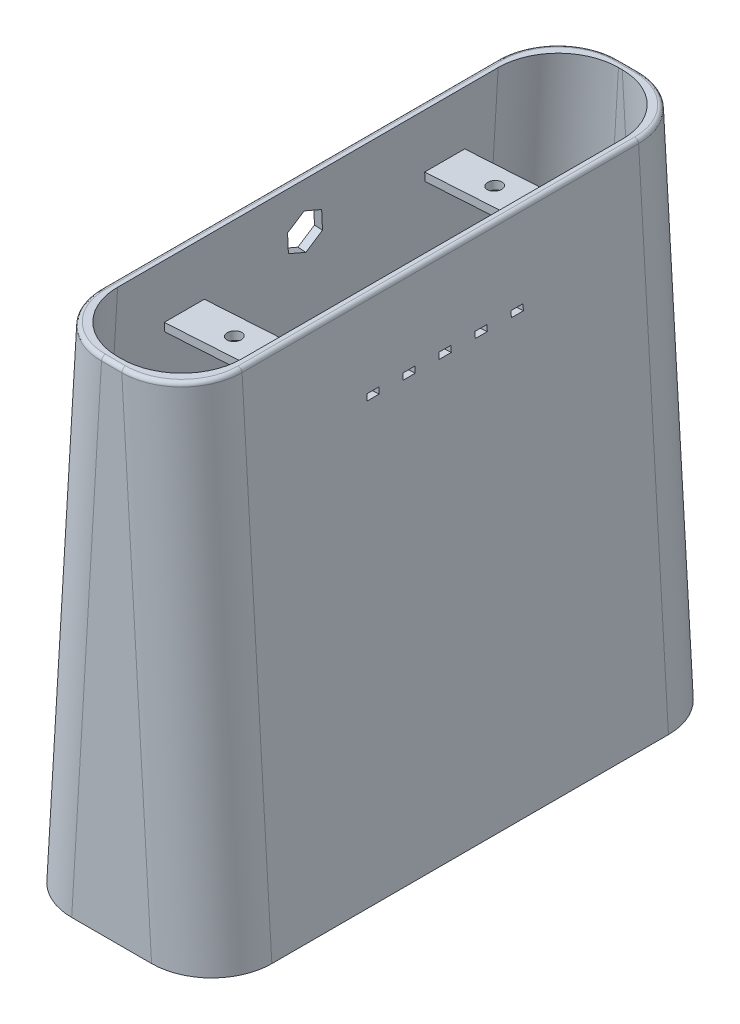
from build123d import *

# Parameters (mm, degrees)
BOSS_EXTRU_1_DEPTH       = 2
BOSS_EXTRU_2_DEPTH       = 125
BOSS_EXTRU_3_DEPTH       = 2
ESQUISSE13_W             = 3
ESQUISSE13_H             = 1.5
ENL_V_MAT_EXTRU_2_DEPTH  = 2
ESQUISSE18_W             = 5
ESQUISSE18_H             = 5
BOSS_EXTRU_8_DEPTH       = 6.5
CONG_2_R                 = 15
CONG_3_R                 = 15
ESQUISSE19_W             = 12
ESQUISSE19_H             = 20
ENL_V_MAT_EXTRU_3_DEPTH  = 6.5
ESQUISSE21_W             = 3.5
ESQUISSE21_H             = 9
ENL_V_MAT_EXTRU_4_DEPTH  = 6.5
CONG_4_R                 = 1
ESQUISSE22_W             = 14
ESQUISSE22_H             = 22
ENL_V_MAT_EXTRU_5_DEPTH  = 0.5
ESQUISSE23_W             = 10
ESQUISSE23_H             = 2
BOSS_EXTRU_9_DEPTH       = 30
ESQUISSE24_W             = 10
ESQUISSE24_H             = 5
BOSS_EXTRU_11_DEPTH      = 10
ESQUISSE26_R             = 1.75
ENL_V_MAT_EXTRU_6_DEPTH  = 10
ENL_V_MAT_EXTRU_9_DEPTH  = 6
CONG_7_R                 = 1
ESQUISSE25_W             = 10
ESQUISSE25_H             = 5
BOSS_EXTRU_12_DEPTH      = 10
ESQUISSE34_R             = 1.75
ENL_V_MAT_EXTRU_16_DEPTH = 10
ESQUISSE35_R             = 1.75
ENL_V_MAT_EXTRU_17_DEPTH = 10
FILETAGE3_PITCH          = 0.8
FILETAGE4_PITCH          = 0.8
FILETAGE5_PITCH          = 0.8
FILETAGE6_PITCH          = 0.8


with BuildPart() as part:
    # Esquisse9 → Boss.-Extru.1 (new body)
    with BuildSketch(Plane.XY):
        Polygon((-42.5, 125), (-50, 0), (0, 0), (-7.5, 125), align=None)
    extrude(amount=BOSS_EXTRU_1_DEPTH)

    # Esquisse10 → Boss.-Extru.2 (add)
    with BuildSketch(Plane(origin=(0, 0, 0), x_dir=(-1, 0, 0), z_dir=(0, 0, -1))):
        Polygon((2.003596766, 0), (9.503596766, 125), (7.5, 125), (0, 0), align=None)
        Polygon((42.5, 125), (40.496403234, 125), (47.996403234, 0), (50, 0), align=None)
    extrude(amount=BOSS_EXTRU_2_DEPTH)

    # Esquisse11 → Boss.-Extru.3 (add)
    with BuildSketch(Plane(origin=(0, 0, -125), x_dir=(-1, 0, 0), z_dir=(0, 0, -1))):
        Polygon((7.5, 125), (42.5, 125), (50, 0), (0, 0), align=None)
    extrude(amount=BOSS_EXTRU_3_DEPTH)

    # Esquisse13 → Enlèv. mat.-Extru.2 (cut)
    with BuildSketch(Plane(origin=(0, 0, 0), x_dir=(0, 0, -1), z_dir=(0.9982048454657787, 0.05989229072794678, 0))):
        with Locations((44.5, 104.474797864)):
            Rectangle(ESQUISSE13_W, ESQUISSE13_H)
        with Locations((53.5, 104.474797864)):
            Rectangle(ESQUISSE13_W, ESQUISSE13_H)
        with Locations((62.5, 104.474797864)):
            Rectangle(ESQUISSE13_W, ESQUISSE13_H)
        with Locations((71.5, 104.474797864)):
            Rectangle(ESQUISSE13_W, ESQUISSE13_H)
        with Locations((80.5, 104.474797864)):
            Rectangle(ESQUISSE13_W, ESQUISSE13_H)
    extrude(amount=-ENL_V_MAT_EXTRU_2_DEPTH, mode=Mode.SUBTRACT)

    # Esquisse18 → Boss.-Extru.8 (add)
    with BuildSketch(Plane(origin=(-47.824235985, 2.869454159, 0), x_dir=(0, 0, -1), z_dir=(0.9982048454657787, -0.059892290727946586, 0))):
        with Locations((27.5, 9.625385464)):
            Rectangle(ESQUISSE18_W, ESQUISSE18_H)
        with Locations((97.5, 9.625385464)):
            Rectangle(ESQUISSE18_W, ESQUISSE18_H)
    extrude(amount=BOSS_EXTRU_8_DEPTH)

    # Congé2
    cong_2_edges = [part.edges().sort_by_distance(p)[0] for p in [
        (-5.753596766, 62.5, -125),
        (-3.75, 62.5, 2),
        (-5.753596766, 62.5, 0),
        (-44.246403234, 62.5, -125),
        (-44.246403234, 62.5, 0),
        (-3.75, 62.5, -127),
        (-46.25, 62.5, 2),
    ]]
    fillet(cong_2_edges, radius=CONG_2_R)

    # Congé3
    cong_3_edges = [part.edges().sort_by_distance(p)[0] for p in [
        (-46.25, 62.5, -127),
    ]]
    fillet(cong_3_edges, radius=CONG_3_R)

    # Esquisse19 → Enlèv. mat.-Extru.3 (cut)
    with BuildSketch(Plane(origin=(0, 0, -127), x_dir=(-1, 0, 0), z_dir=(0, 0, -1))):
        with Locations((25.013024256, 17.5)):
            Rectangle(ESQUISSE19_W, ESQUISSE19_H)
    extrude(amount=-ENL_V_MAT_EXTRU_3_DEPTH, mode=Mode.SUBTRACT)

    # Esquisse21 → Enlèv. mat.-Extru.4 (cut)
    with BuildSketch(Plane(origin=(0, 0, -127), x_dir=(-1, 0, 0), z_dir=(0, 0, -1))):
        with Locations((24.986975744, 37)):
            Rectangle(ESQUISSE21_W, ESQUISSE21_H)
    extrude(amount=-ENL_V_MAT_EXTRU_4_DEPTH, mode=Mode.SUBTRACT)

    # Congé4
    cong_4_edges = [part.edges().sort_by_distance(p)[0] for p in [
        (-23.236975744, 32.5, -126),
        (-23.236975744, 41.5, -126),
        (-26.736975744, 41.5, -126),
        (-26.736975744, 32.5, -126),
    ]]
    fillet(cong_4_edges, radius=CONG_4_R)

    # Esquisse22 → Enlèv. mat.-Extru.5 (cut)
    with BuildSketch(Plane.XY.offset(-125)):
        with Locations((-25.013024256, 17.5)):
            Rectangle(ESQUISSE22_W, ESQUISSE22_H)
    extrude(amount=-ENL_V_MAT_EXTRU_5_DEPTH, mode=Mode.SUBTRACT)

    # Esquisse23 → Boss.-Extru.9 (add)
    with BuildSketch(Plane(origin=(-1.996409691, -0.119784581, 0), x_dir=(0, 0, 1), z_dir=(-0.9982048454657787, -0.05989229072794677, 0))):
        with Locations((-95, 114.344797864)):
            Rectangle(ESQUISSE23_W, ESQUISSE23_H)
        with Locations((-30, 114.344797864)):
            Rectangle(ESQUISSE23_W, ESQUISSE23_H)
    extrude(amount=BOSS_EXTRU_9_DEPTH)

    # Esquisse24 → Boss.-Extru.11 (add)
    with BuildSketch(Plane(origin=(-47.824235985, 2.869454159, 0), x_dir=(0, 0, -1), z_dir=(0.9982048454657787, -0.059892290727946586, 0))):
        with Locations((20, -0.374614536)):
            Rectangle(ESQUISSE24_W, ESQUISSE24_H)
        with Locations((105, -0.374614536)):
            Rectangle(ESQUISSE24_W, ESQUISSE24_H)
    extrude(amount=BOSS_EXTRU_11_DEPTH)

    # Esquisse26 → Enlèv. mat.-Extru.6 (cut)
    with BuildSketch(Plane(origin=(-6.788479586, 113.141326436, 0), x_dir=(-0.9982048454657787, -0.05989229072794676, 0), z_dir=(0.05989229072794676, -0.9982048454657787, 0))):
        with Locations(Location((19.5, 30, 0), (0, 0, 180))):
            Circle(ESQUISSE26_R)
        with Locations(Location((19.5, 95, 0), (0, 0, 180))):
            Circle(ESQUISSE26_R)
    extrude(amount=-ENL_V_MAT_EXTRU_6_DEPTH, mode=Mode.SUBTRACT)

    # Esquisse28 → Enlèv. mat.-Extru.9 (cut)
    with BuildSketch(Plane(origin=(-49.820645676, 2.989238741, 0), x_dir=(0, 0, 1), z_dir=(-0.9982048454657787, 0.05989229072794659, 0))):
        Polygon((-66.477883631, 113.104165782), (-66.977883631, 108.222226277), (-63, 105.348243822), (-58.522116369, 107.356200873), (-58.022116369, 112.238140378), (-62, 115.112122833), align=None)
    extrude(amount=-ENL_V_MAT_EXTRU_9_DEPTH, mode=Mode.SUBTRACT)

    # Congé7
    cong_7_edges = [part.edges().sort_by_distance(p)[0] for p in [
        (-25, 125, -127),
        (-7.5, 125, -62.5),
        (-25, 125, 2),
        (-42.5, 125, -62.5),
        (-11.906073329, 125, -2.388634958),
        (-38.093926671, 125, -2.388634958),
        (-11.906073329, 125, -122.611365042),
        (-38.093926671, 125, -122.611365042),
    ]]
    fillet(cong_7_edges, radius=CONG_7_R)

    # Esquisse25 → Boss.-Extru.12 (add)
    with BuildSketch(Plane(origin=(-1.996409691, -0.119784581, 0), x_dir=(0, 0, 1), z_dir=(-0.9982048454657787, -0.05989229072794677, 0))):
        with Locations((-105, 2.62)):
            Rectangle(ESQUISSE25_W, ESQUISSE25_H)
        with Locations((-20, 2.62)):
            Rectangle(ESQUISSE25_W, ESQUISSE25_H)
    extrude(amount=BOSS_EXTRU_12_DEPTH)

    # Esquisse34 → Enlèv. mat.-Extru.16 (cut)
    with BuildSketch(Plane(origin=(-0.17216725, -2.869454159, 0), x_dir=(-0.9982048454657787, 0.059892290727946586, 0), z_dir=(-0.05989229072794659, -0.9982048454657788, 0))):
        with Locations(Location((42.910242273, 20, 0), (0, 0, 180))):
            Circle(ESQUISSE34_R)
        with Locations(Location((42.910242273, 105, 0), (0, 0, 180))):
            Circle(ESQUISSE34_R)
    extrude(amount=-ENL_V_MAT_EXTRU_16_DEPTH, mode=Mode.SUBTRACT)

    # Esquisse35 → Enlèv. mat.-Extru.17 (cut)
    with BuildSketch(Plane(origin=(-0.007187075, 0.119784581, 0), x_dir=(-0.9982048454657787, -0.05989229072794677, 0), z_dir=(0.05989229072794678, -0.9982048454657788, 0))):
        with Locations(Location((7, 20, 0), (0, 0, 180))):
            Circle(ESQUISSE35_R)
        with Locations(Location((7, 105, 0), (0, 0, 180))):
            Circle(ESQUISSE35_R)
    extrude(amount=-ENL_V_MAT_EXTRU_17_DEPTH, mode=Mode.SUBTRACT)

    # Filetage3: arcs per turn and ends read off the stored shape
    # Filetage3: the profile of Profil de filetage3 profile screwed along a right-hand helix through 8.75 turns, 8 arcs to a turn; built about Z, then put on its axis
    filetage3_z = Axis((0, 0, 0), (0, 0, 1))
    filetage3_corners = [(1.7497, 0, -0.000173205), (2.1830127, 0, 0.249999999), (2.1830127, 0, 0.349999999), (1.7497, 0, 0.600173203)]
    with BuildLine(mode=Mode.PRIVATE) as filetage3_profile:
        Line(filetage3_corners[0], filetage3_corners[1])
        Line(filetage3_corners[1], filetage3_corners[2])
        Line(filetage3_corners[2], filetage3_corners[3])
        Line(filetage3_corners[3], filetage3_corners[0])
    filetage3_cap = Face(filetage3_profile.wire())
    filetage3_turn_angles = [0, 22.5, 45, 67.5, 90, 112.5, 135, 157.5, 180, 202.5, 225, 247.5, 270, 292.5, 315, 337.5, 360]
    filetage3_turn_weights = [1, 0.9238795325112867, 1, 0.9238795325112867, 1, 0.9238795325112867, 1, 0.9238795325112867, 1, 0.9238795325112867, 1, 0.9238795325112867, 1, 0.9238795325112867, 1, 0.9238795325112867, 1]
    filetage3_turn_rails = [Edge.make_bspline([Vector(p[0], p[1], 0).rotate(filetage3_z, filetage3_turn_angles[k]) / filetage3_turn_weights[k] + Vector(0, 0, p[2] + FILETAGE3_PITCH * filetage3_turn_angles[k] / 360) for k in range(17)], [0, 0, 0, 1, 1, 2, 2, 3, 3, 4, 4, 5, 5, 6, 6, 7, 7, 8, 8, 8], 2, filetage3_turn_weights) for p in filetage3_corners]
    filetage3_turn_sides = [Face.make_surface_from_curves(filetage3_turn_rails[p[0]], filetage3_turn_rails[p[1]]) for p in [(0, 1), (1, 2), (2, 3), (3, 0)]]
    filetage3_last_angles = [2880, 2902.5, 2925, 2947.5, 2970, 2992.5, 3015, 3037.5, 3060, 3082.5, 3105, 3127.5, 3150]
    filetage3_last_weights = [1, 0.9238795325112867, 1, 0.9238795325112867, 1, 0.9238795325112867, 1, 0.9238795325112867, 1, 0.9238795325112867, 1, 0.9238795325112867, 1]
    filetage3_last_rails = [Edge.make_bspline([Vector(p[0], p[1], 0).rotate(filetage3_z, filetage3_last_angles[k]) / filetage3_last_weights[k] + Vector(0, 0, p[2] + FILETAGE3_PITCH * filetage3_last_angles[k] / 360) for k in range(13)], [0, 0, 0, 1, 1, 2, 2, 3, 3, 4, 4, 5, 5, 6, 6, 6], 2, filetage3_last_weights) for p in filetage3_corners]
    filetage3_last_sides = [Face.make_surface_from_curves(filetage3_last_rails[p[0]], filetage3_last_rails[p[1]]) for p in [(0, 1), (1, 2), (2, 3), (3, 0)]]
    filetage3 = Plane(origin=(-43.065271298, -1.297666299, -20), x_dir=(0.998204845, -0.059892291, 0), z_dir=(0.059892291, 0.998204845, 0)) * Solid(Shell([*[p.moved(Location((0, 0, FILETAGE3_PITCH * i))) for i in range(8) for p in filetage3_turn_sides], *filetage3_last_sides, filetage3_cap, filetage3_cap.rotate(filetage3_z, 3150).moved(Location((0, 0, FILETAGE3_PITCH * 3150 / 360)))]))
    add(filetage3, mode=Mode.SUBTRACT)

    # Filetage4: arcs per turn and ends read off the stored shape
    # Filetage4: the profile of Profil de filetage4 profile screwed along a right-hand helix through 7.5 turns, 8 arcs to a turn; built about Z, then put on its axis
    filetage4_z = Axis((0, 0, 0), (0, 0, 1))
    filetage4_corners = [(1.7497, 0, -0.000173205), (2.1830127, 0, 0.249999999), (2.1830127, 0, 0.349999999), (1.7497, 0, 0.600173203)]
    with BuildLine(mode=Mode.PRIVATE) as filetage4_profile:
        Line(filetage4_corners[0], filetage4_corners[1])
        Line(filetage4_corners[1], filetage4_corners[2])
        Line(filetage4_corners[2], filetage4_corners[3])
        Line(filetage4_corners[3], filetage4_corners[0])
    filetage4_cap = Face(filetage4_profile.wire())
    filetage4_turn_angles = [0, 22.5, 45, 67.5, 90, 112.5, 135, 157.5, 180, 202.5, 225, 247.5, 270, 292.5, 315, 337.5, 360]
    filetage4_turn_weights = [1, 0.9238795325112867, 1, 0.9238795325112867, 1, 0.9238795325112867, 1, 0.9238795325112867, 1, 0.9238795325112867, 1, 0.9238795325112867, 1, 0.9238795325112867, 1, 0.9238795325112867, 1]
    filetage4_turn_rails = [Edge.make_bspline([Vector(p[0], p[1], 0).rotate(filetage4_z, filetage4_turn_angles[k]) / filetage4_turn_weights[k] + Vector(0, 0, p[2] + FILETAGE4_PITCH * filetage4_turn_angles[k] / 360) for k in range(17)], [0, 0, 0, 1, 1, 2, 2, 3, 3, 4, 4, 5, 5, 6, 6, 7, 7, 8, 8, 8], 2, filetage4_turn_weights) for p in filetage4_corners]
    filetage4_turn_sides = [Face.make_surface_from_curves(filetage4_turn_rails[p[0]], filetage4_turn_rails[p[1]]) for p in [(0, 1), (1, 2), (2, 3), (3, 0)]]
    filetage4_last_angles = [2520, 2542.5, 2565, 2587.5, 2610, 2632.5, 2655, 2677.5, 2700]
    filetage4_last_weights = [1, 0.9238795325112867, 1, 0.9238795325112867, 1, 0.9238795325112867, 1, 0.9238795325112928, 1]
    filetage4_last_rails = [Edge.make_bspline([Vector(p[0], p[1], 0).rotate(filetage4_z, filetage4_last_angles[k]) / filetage4_last_weights[k] + Vector(0, 0, p[2] + FILETAGE4_PITCH * filetage4_last_angles[k] / 360) for k in range(9)], [0, 0, 0, 1, 1, 2, 2, 3, 3, 4, 4, 4], 2, filetage4_last_weights) for p in filetage4_corners]
    filetage4_last_sides = [Face.make_surface_from_curves(filetage4_last_rails[p[0]], filetage4_last_rails[p[1]]) for p in [(0, 1), (1, 2), (2, 3), (3, 0)]]
    filetage4 = Plane(origin=(-42.646025262, 5.689767619, -105), x_dir=(-0.998204845, 0.059892291, 0), z_dir=(-0.059892291, -0.998204845, 0)) * Solid(Shell([*[p.moved(Location((0, 0, FILETAGE4_PITCH * i))) for i in range(7) for p in filetage4_turn_sides], *filetage4_last_sides, filetage4_cap, filetage4_cap.rotate(filetage4_z, 2700).moved(Location((0, 0, FILETAGE4_PITCH * 2700 / 360)))]))
    add(filetage4, mode=Mode.SUBTRACT)

    # Filetage5: arcs per turn and ends read off the stored shape
    # Filetage5: the profile of Profil de filetage5 profile screwed along a right-hand helix through 7.5 turns, 8 arcs to a turn; built about Z, then put on its axis
    filetage5_z = Axis((0, 0, 0), (0, 0, 1))
    filetage5_corners = [(1.7497, 0, -0.000173206), (2.1830127, 0, 0.249999998), (2.1830127, 0, 0.349999998), (1.7497, 0, 0.600173202)]
    with BuildLine(mode=Mode.PRIVATE) as filetage5_profile:
        Line(filetage5_corners[0], filetage5_corners[1])
        Line(filetage5_corners[1], filetage5_corners[2])
        Line(filetage5_corners[2], filetage5_corners[3])
        Line(filetage5_corners[3], filetage5_corners[0])
    filetage5_cap = Face(filetage5_profile.wire())
    filetage5_turn_angles = [0, 22.5, 45, 67.5, 90, 112.5, 135, 157.5, 180, 202.5, 225, 247.5, 270, 292.5, 315, 337.5, 360]
    filetage5_turn_weights = [1, 0.9238795325112867, 1, 0.9238795325112867, 1, 0.9238795325112867, 1, 0.9238795325112867, 1, 0.9238795325112867, 1, 0.9238795325112867, 1, 0.9238795325112867, 1, 0.9238795325112867, 1]
    filetage5_turn_rails = [Edge.make_bspline([Vector(p[0], p[1], 0).rotate(filetage5_z, filetage5_turn_angles[k]) / filetage5_turn_weights[k] + Vector(0, 0, p[2] + FILETAGE5_PITCH * filetage5_turn_angles[k] / 360) for k in range(17)], [0, 0, 0, 1, 1, 2, 2, 3, 3, 4, 4, 5, 5, 6, 6, 7, 7, 8, 8, 8], 2, filetage5_turn_weights) for p in filetage5_corners]
    filetage5_turn_sides = [Face.make_surface_from_curves(filetage5_turn_rails[p[0]], filetage5_turn_rails[p[1]]) for p in [(0, 1), (1, 2), (2, 3), (3, 0)]]
    filetage5_last_angles = [2520, 2542.5, 2565, 2587.5, 2610, 2632.5, 2655, 2677.5, 2700]
    filetage5_last_weights = [1, 0.9238795325112867, 1, 0.9238795325112867, 1, 0.9238795325112867, 1, 0.9238795325112852, 1]
    filetage5_last_rails = [Edge.make_bspline([Vector(p[0], p[1], 0).rotate(filetage5_z, filetage5_last_angles[k]) / filetage5_last_weights[k] + Vector(0, 0, p[2] + FILETAGE5_PITCH * filetage5_last_angles[k] / 360) for k in range(9)], [0, 0, 0, 1, 1, 2, 2, 3, 3, 4, 4, 4], 2, filetage5_last_weights) for p in filetage5_corners]
    filetage5_last_sides = [Face.make_surface_from_curves(filetage5_last_rails[p[0]], filetage5_last_rails[p[1]]) for p in [(0, 1), (1, 2), (2, 3), (3, 0)]]
    filetage5 = Plane(origin=(-7.353974738, 5.689767619, -20), x_dir=(-0.998204845, -0.059892291, 0), z_dir=(0.059892291, -0.998204845, 0)) * Solid(Shell([*[p.moved(Location((0, 0, FILETAGE5_PITCH * i))) for i in range(7) for p in filetage5_turn_sides], *filetage5_last_sides, filetage5_cap, filetage5_cap.rotate(filetage5_z, 2700).moved(Location((0, 0, FILETAGE5_PITCH * 2700 / 360)))]))
    add(filetage5, mode=Mode.SUBTRACT)

    # Filetage6: arcs per turn and ends read off the stored shape
    # Filetage6: the profile of Profil de filetage6 profile screwed along a right-hand helix through 7.5 turns, 8 arcs to a turn; built about Z, then put on its axis
    filetage6_z = Axis((0, 0, 0), (0, 0, 1))
    filetage6_corners = [(1.7497, 0, -0.000173206), (2.1830127, 0, 0.249999998), (2.1830127, 0, 0.349999998), (1.7497, 0, 0.600173202)]
    with BuildLine(mode=Mode.PRIVATE) as filetage6_profile:
        Line(filetage6_corners[0], filetage6_corners[1])
        Line(filetage6_corners[1], filetage6_corners[2])
        Line(filetage6_corners[2], filetage6_corners[3])
        Line(filetage6_corners[3], filetage6_corners[0])
    filetage6_cap = Face(filetage6_profile.wire())
    filetage6_turn_angles = [0, 22.5, 45, 67.5, 90, 112.5, 135, 157.5, 180, 202.5, 225, 247.5, 270, 292.5, 315, 337.5, 360]
    filetage6_turn_weights = [1, 0.9238795325112867, 1, 0.9238795325112867, 1, 0.9238795325112867, 1, 0.9238795325112867, 1, 0.9238795325112867, 1, 0.9238795325112867, 1, 0.9238795325112867, 1, 0.9238795325112867, 1]
    filetage6_turn_rails = [Edge.make_bspline([Vector(p[0], p[1], 0).rotate(filetage6_z, filetage6_turn_angles[k]) / filetage6_turn_weights[k] + Vector(0, 0, p[2] + FILETAGE6_PITCH * filetage6_turn_angles[k] / 360) for k in range(17)], [0, 0, 0, 1, 1, 2, 2, 3, 3, 4, 4, 5, 5, 6, 6, 7, 7, 8, 8, 8], 2, filetage6_turn_weights) for p in filetage6_corners]
    filetage6_turn_sides = [Face.make_surface_from_curves(filetage6_turn_rails[p[0]], filetage6_turn_rails[p[1]]) for p in [(0, 1), (1, 2), (2, 3), (3, 0)]]
    filetage6_last_angles = [2520, 2542.5, 2565, 2587.5, 2610, 2632.5, 2655, 2677.5, 2700]
    filetage6_last_weights = [1, 0.9238795325112867, 1, 0.9238795325112867, 1, 0.9238795325112867, 1, 0.9238795325112776, 1]
    filetage6_last_rails = [Edge.make_bspline([Vector(p[0], p[1], 0).rotate(filetage6_z, filetage6_last_angles[k]) / filetage6_last_weights[k] + Vector(0, 0, p[2] + FILETAGE6_PITCH * filetage6_last_angles[k] / 360) for k in range(9)], [0, 0, 0, 1, 1, 2, 2, 3, 3, 4, 4, 4], 2, filetage6_last_weights) for p in filetage6_corners]
    filetage6_last_sides = [Face.make_surface_from_curves(filetage6_last_rails[p[0]], filetage6_last_rails[p[1]]) for p in [(0, 1), (1, 2), (2, 3), (3, 0)]]
    filetage6 = Plane(origin=(-7.353974738, 5.689767619, -105), x_dir=(-0.998204845, -0.059892291, 0), z_dir=(0.059892291, -0.998204845, 0)) * Solid(Shell([*[p.moved(Location((0, 0, FILETAGE6_PITCH * i))) for i in range(7) for p in filetage6_turn_sides], *filetage6_last_sides, filetage6_cap, filetage6_cap.rotate(filetage6_z, 2700).moved(Location((0, 0, FILETAGE6_PITCH * 2700 / 360)))]))
    add(filetage6, mode=Mode.SUBTRACT)


solid = part.part
